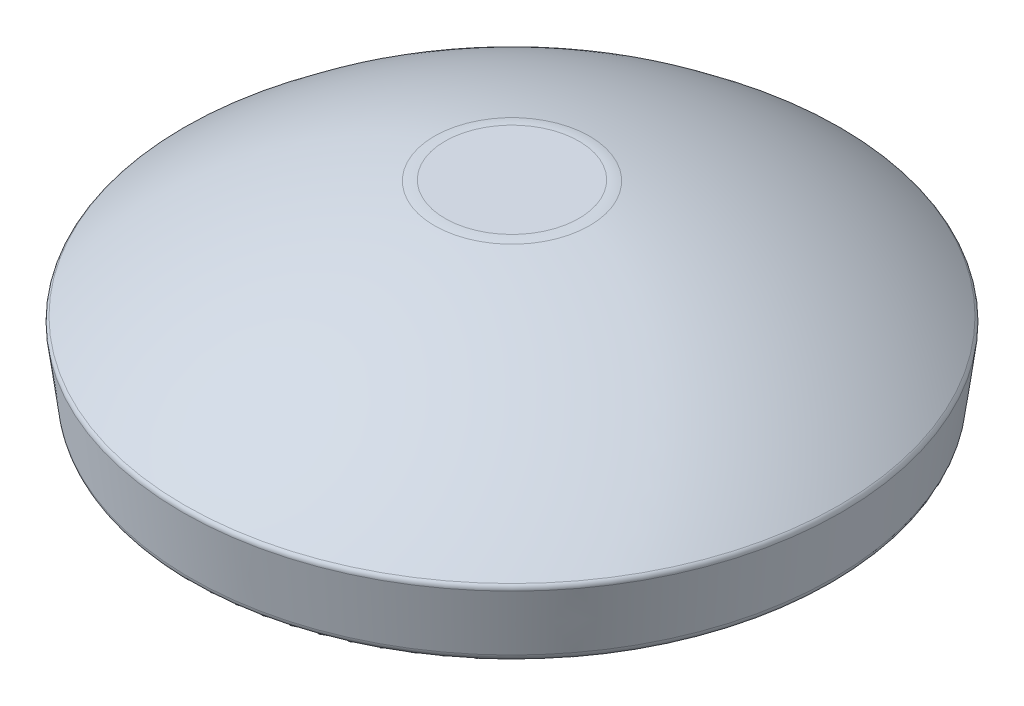
from build123d import *

# Parameters (mm, degrees)
BOSS_EXTRUDE1_DEPTH = 2.54
BOTTOM_TOP_ROUNDS_R = 2.54
SIDE_ROUND_R        = 0.254
MATCH_TOOL_RADIUS_R = 0.4064


with BuildPart() as part:
    # Sketch2 → Revolve1 (revolve)
    with BuildSketch(Plane.XY):
        with BuildLine():
            Line((0, 0), (14.097, 0))
            Line((14.097, 0), (14.51499668, 3.175))
            ThreePointArc((14.51499668, 3.175), (9.193082758, 6.56543309), (3.175, 8.462927295))
            Line((3.175, 8.462927295), (0, 8.462927295))
            Line((0, 8.462927295), (0, 0))
        make_face()
    revolve(axis=Axis((0, 0, 0), (0, 1, 0)))

    # Sketch3 → Boss-Extrude1 (add)
    with BuildSketch(Plane.XZ):
        with BuildLine():
            Line((-3.074180531, 0.79375), (3.074180531, 0.79375))
            ThreePointArc((3.074180531, 0.79375), (0, 3.175), (-3.074180531, 0.79375))
        make_face()
        with BuildLine():
            Line((-3.074180531, -0.79375), (3.074180531, -0.79375))
            ThreePointArc((3.074180531, -0.79375), (0, -3.175), (-3.074180531, -0.79375))
        make_face()
    extrude(amount=BOSS_EXTRUDE1_DEPTH)

    # Bottom/Top Rounds
    # the kernel refuses this fillet: 2.54 mm, written as the material it adds along each edge
    with BuildSketch(Plane(origin=(0, 0, 0), x_dir=(0.0031415874858799556, 0, 0.9999950652018581), z_dir=(-0.9999950652018581, 0, 0.0031415874858799556))) as bottom_top_rounds_piece_1_section:
        with BuildLine():
            CenterArc((3.175 + BOTTOM_TOP_ROUNDS_R, -BOTTOM_TOP_ROUNDS_R), BOTTOM_TOP_ROUNDS_R, 90, 90)
            Line((3.175, -BOTTOM_TOP_ROUNDS_R), (3.175, 0))
            Line((3.175, 0), (3.175 + BOTTOM_TOP_ROUNDS_R, 0))
        make_face()
    bottom_top_rounds_piece_1 = revolve(axis=Axis((0, 0, 0), (0, 1, 0)), revolution_arc=359.64, mode=Mode.PRIVATE)
    bottom_top_rounds_piece_1 = split(bottom_top_rounds_piece_1, bisect_by=Plane(origin=(2.222683087, -0.525983554, 0.79375), z_dir=(0, 0, 1)), keep=Keep.TOP, mode=Mode.PRIVATE)
    add(bottom_top_rounds_piece_1)
    with BuildSketch(Plane(origin=(0, 0, 0), x_dir=(0.0031415874858799556, 0, 0.9999950652018581), z_dir=(-0.9999950652018581, 0, 0.0031415874858799556))) as bottom_top_rounds_piece_2_section:
        with BuildLine():
            CenterArc((3.175 + BOTTOM_TOP_ROUNDS_R, -BOTTOM_TOP_ROUNDS_R), BOTTOM_TOP_ROUNDS_R, 90, 90)
            Line((3.175, -BOTTOM_TOP_ROUNDS_R), (3.175, 0))
            Line((3.175, 0), (3.175 + BOTTOM_TOP_ROUNDS_R, 0))
        make_face()
    bottom_top_rounds_piece_2 = revolve(axis=Axis((0, 0, 0), (0, 1, 0)), revolution_arc=359.64, mode=Mode.PRIVATE)
    bottom_top_rounds_piece_2 = split(bottom_top_rounds_piece_2, bisect_by=Plane(origin=(0, -0.726881266, -0.79375), z_dir=(0, 0, -1)), keep=Keep.TOP, mode=Mode.PRIVATE)
    add(bottom_top_rounds_piece_2)
    with BuildSketch(Plane(origin=(0, 0, 0), x_dir=(0.0031415874858799556, 0, -0.9999950652018581), z_dir=(-0.9999950652018581, 0, -0.0031415874858799556))) as bottom_top_rounds_piece_3_section:
        with BuildLine():
            CenterArc((3.175 + BOTTOM_TOP_ROUNDS_R, BOTTOM_TOP_ROUNDS_R), BOTTOM_TOP_ROUNDS_R, 180, 90)
            Line((3.175, BOTTOM_TOP_ROUNDS_R), (3.175, 0))
            Line((3.175, 0), (3.175 + BOTTOM_TOP_ROUNDS_R, 0))
        make_face()
    bottom_top_rounds_piece_3 = revolve(axis=Axis((0, 0, 0), (0, -1, 0)), revolution_arc=359.64, mode=Mode.PRIVATE)
    bottom_top_rounds_piece_3 = split(bottom_top_rounds_piece_3, bisect_by=Plane(origin=(2.222683087, -0.525983554, -0.79375), z_dir=(0, 0, -1)), keep=Keep.TOP, mode=Mode.PRIVATE)
    add(bottom_top_rounds_piece_3)
    with BuildSketch(Plane(origin=(0, 0, 0), x_dir=(0.0031415874858799556, 0, -0.9999950652018581), z_dir=(-0.9999950652018581, 0, -0.0031415874858799556))) as bottom_top_rounds_piece_4_section:
        with BuildLine():
            CenterArc((3.175 + BOTTOM_TOP_ROUNDS_R, BOTTOM_TOP_ROUNDS_R), BOTTOM_TOP_ROUNDS_R, 180, 90)
            Line((3.175, BOTTOM_TOP_ROUNDS_R), (3.175, 0))
            Line((3.175, 0), (3.175 + BOTTOM_TOP_ROUNDS_R, 0))
        make_face()
    bottom_top_rounds_piece_4 = revolve(axis=Axis((0, 0, 0), (0, -1, 0)), revolution_arc=359.64, mode=Mode.PRIVATE)
    bottom_top_rounds_piece_4 = split(bottom_top_rounds_piece_4, bisect_by=Plane(origin=(0, -0.726881266, 0.79375), z_dir=(0, 0, 1)), keep=Keep.TOP, mode=Mode.PRIVATE)
    add(bottom_top_rounds_piece_4)
    # the kernel refuses this fillet: 2.54 mm, written as the material it takes off along each edge
    with BuildSketch(Plane(origin=(0, 8.462927295, 0), x_dir=(1, 0, 0), z_dir=(0, 0, 1))) as bottom_top_rounds_2_piece_1:
        with BuildLine():
            CenterArc((2.946562621, -2.54), BOTTOM_TOP_ROUNDS_R, 79.427614444, 10.572385556)
            ThreePointArc((3.412595702, -0.043119312), (3.293851696, -0.021262958), (3.175, 0))
            Line((3.175, 0), (2.946562621, 0))
        make_face()
    revolve(axis=Axis((0, 8.462927295, 0), (0, 1, 0)), mode=Mode.SUBTRACT)

    # Side Round
    side_round_edges = [part.edges().sort_by_distance(p)[0] for p in [
        (-14.51499668, 3.175, 0),
    ]]
    fillet(side_round_edges, radius=SIDE_ROUND_R)

    # Match Tool Radius
    match_tool_radius_edges = [part.edges().sort_by_distance(p)[0] for p in [
        (-14.097, 0, 0),
    ]]
    fillet(match_tool_radius_edges, radius=MATCH_TOOL_RADIUS_R)


solid = part.part
